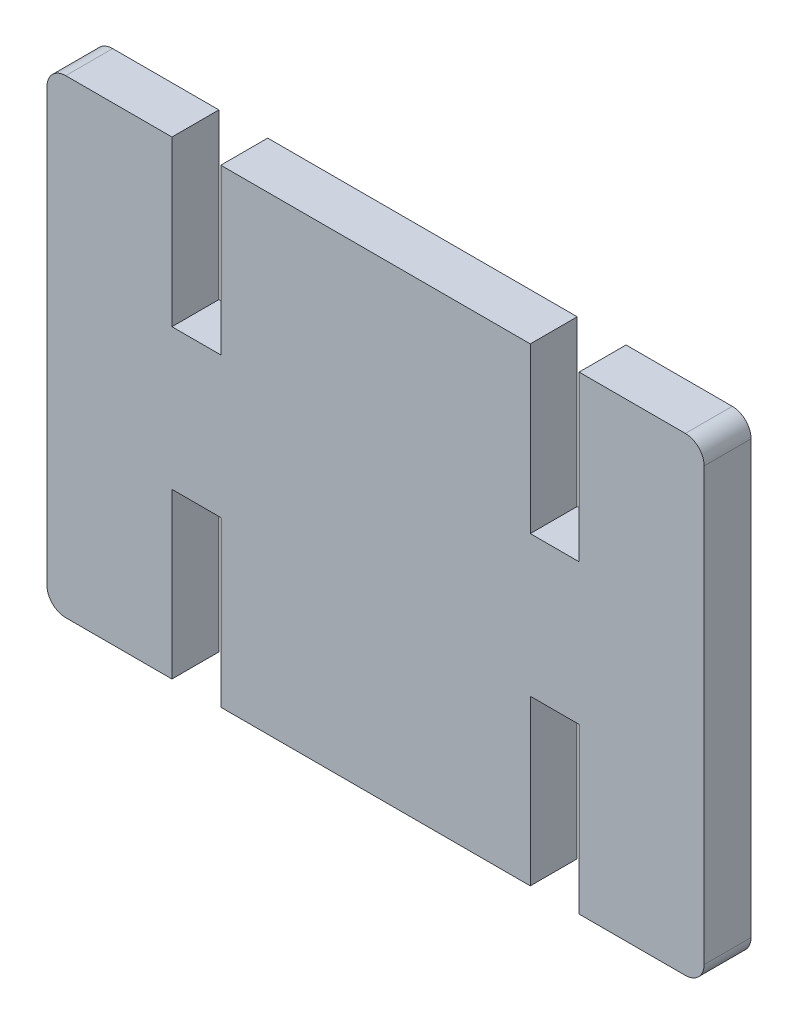
from build123d import *

# Parameters (mm, degrees)
BOSS_EXTRUDE1_DEPTH = 5
SKETCH2_W           = 5.2
SKETCH2_H           = 17.5
CUT_EXTRUDE1_DEPTH  = 5


with BuildPart() as part:
    # Sketch1 → Boss-Extrude1 (new body)
    with BuildSketch(Plane.XY):
        with BuildLine():
            Line((2, 0), (68, 0))
            ThreePointArc((68, 0), (69.414213562, 0.585786438), (70, 2))
            Line((70, 2), (70, 48))
            ThreePointArc((70, 48), (69.414213562, 49.414213562), (68, 50))
            Line((68, 50), (2, 50))
            ThreePointArc((2, 50), (0.585786438, 49.414213562), (0, 48))
            Line((0, 48), (0, 2))
            ThreePointArc((0, 2), (0.585786438, 0.585786438), (2, 0))
        make_face()
    extrude(amount=BOSS_EXTRUDE1_DEPTH)

    # Sketch2 → Cut-Extrude1 (cut)
    with BuildSketch(Plane(origin=(-23.39926368, 94.916866164, 5), x_dir=(1, 0, 0), z_dir=(0, 0, 1))):
        with Locations((39.316333928, -53.666866164)):
            Rectangle(SKETCH2_W, SKETCH2_H)
        with Locations((77.482193432, -53.666866164)):
            Rectangle(SKETCH2_W, SKETCH2_H)
        with Locations((39.316333928, -86.166866164)):
            Rectangle(SKETCH2_W, SKETCH2_H)
        with Locations((77.482193432, -86.166866164)):
            Rectangle(SKETCH2_W, SKETCH2_H)
    extrude(amount=-CUT_EXTRUDE1_DEPTH, mode=Mode.SUBTRACT)


solid = part.part
